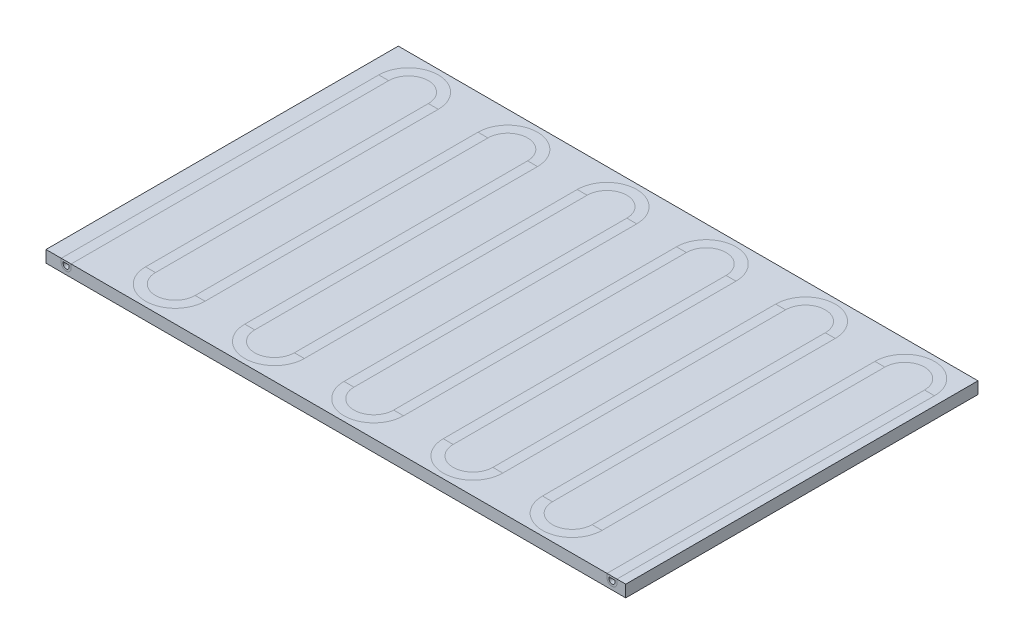
from build123d import *

# Parameters (mm, degrees)
SKETCH1_W        = 292.1
SKETCH1_H        = 177.5
BASE_PLATE_DEPTH = 6


with BuildPart() as part:
    # Sketch1 → Base Plate (new body)
    with BuildSketch(Plane(origin=(0, 0, 0), x_dir=(1, 0, 0), z_dir=(0, 1, 0))):
        Rectangle(SKETCH1_W, SKETCH1_H)
    extrude(amount=BASE_PLATE_DEPTH)

    # Tube Channel: sweep along a path in Sketch5
    with BuildLine(Plane(origin=(0, 6, 0), x_dir=(1, 0, 0), z_dir=(0, 1, 0))) as tube_channel_path:
        Line((-135.89, -88.75), (-135.89, 71.250000235))
        ThreePointArc((-135.89, 71.250000235), (-123.390000235, 83.75), (-110.89000047, 71.250000235))
        Line((-110.89000047, 71.250000235), (-110.89000047, -71.250000235))
        ThreePointArc((-110.89000047, -71.250000235), (-98.390000705, -83.75), (-85.89000094, -71.250000235))
        Line((-85.89000094, -71.250000235), (-85.89000094, 71.250000235))
        ThreePointArc((-85.89000094, 71.250000235), (-73.390001175, 83.75), (-60.89000141, 71.250000235))
        Line((-60.89000141, 71.250000235), (-60.89000141, -71.250000235))
        ThreePointArc((-60.89000141, -71.250000235), (-48.390001645, -83.75), (-35.89000188, -71.250000235))
        Line((-35.89000188, -71.250000235), (-35.89000188, 71.250000235))
        ThreePointArc((-35.89000188, 71.250000235), (-23.390002115, 83.75), (-10.89000235, 71.250000235))
        Line((-10.89000235, 71.250000235), (-10.89000235, -71.250000235))
        ThreePointArc((-10.89000235, -71.250000235), (1.609997415, -83.75), (14.10999718, -71.250000235))
        Line((14.10999718, -71.250000235), (14.10999718, 71.250000235))
        ThreePointArc((14.10999718, 71.250000235), (26.609996945, 83.75), (39.10999671, 71.250000235))
        Line((39.10999671, 71.250000235), (39.10999671, -71.250000235))
        ThreePointArc((39.10999671, -71.250000235), (51.609996475, -83.75), (64.10999624, -71.250000235))
        Line((64.10999624, -71.250000235), (64.10999624, 71.250000235))
        ThreePointArc((64.10999624, 71.250000235), (76.609996005, 83.75), (89.10999577, 71.250000235))
        Line((89.10999577, 71.250000235), (89.10999577, -71.250000235))
        ThreePointArc((89.10999577, -71.250000235), (101.609995535, -83.75), (114.1099953, -71.250000235))
        Line((114.1099953, -71.250000235), (114.1099953, 71.250000235))
        ThreePointArc((114.1099953, 71.250000235), (126.609995065, 83.75), (139.10999483, 71.250000235))
        Line((139.10999483, 71.250000235), (139.10999483, -88.75))
    # Sketch6 → Tube Channel (sweep, cut)
    with BuildSketch(Plane.XY.offset(88.75)):
        with BuildLine():
            Line((-138.389999953, 4.095), (-138.389999953, 6))
            Line((-138.389999953, 6), (-133.390000047, 6))
            Line((-133.390000047, 6), (-133.390000047, 4.095))
            ThreePointArc((-133.390000047, 4.095), (-135.89, 1.595000047), (-138.389999953, 4.095))
        make_face()
    sweep(path=tube_channel_path.line, mode=Mode.SUBTRACT)


with BuildPart() as body_2:
    # Tubing: sweep along a path in Sketch5<3>
    with BuildLine(Plane(origin=(0, 6, 0), x_dir=(1, 0, 0), z_dir=(0, 1, 0))) as tubing_path:
        Line((-135.89, -88.75), (-135.89, 71.250000235))
        ThreePointArc((-135.89, 71.250000235), (-123.390000235, 83.75), (-110.89000047, 71.250000235))
        Line((-110.89000047, 71.250000235), (-110.89000047, -71.250000235))
        ThreePointArc((-110.89000047, -71.250000235), (-98.390000705, -83.75), (-85.89000094, -71.250000235))
        Line((-85.89000094, -71.250000235), (-85.89000094, 71.250000235))
        ThreePointArc((-85.89000094, 71.250000235), (-73.390001175, 83.75), (-60.89000141, 71.250000235))
        Line((-60.89000141, 71.250000235), (-60.89000141, -71.250000235))
        ThreePointArc((-60.89000141, -71.250000235), (-48.390001645, -83.75), (-35.89000188, -71.250000235))
        Line((-35.89000188, -71.250000235), (-35.89000188, 71.250000235))
        ThreePointArc((-35.89000188, 71.250000235), (-23.390002115, 83.75), (-10.89000235, 71.250000235))
        Line((-10.89000235, 71.250000235), (-10.89000235, -71.250000235))
        ThreePointArc((-10.89000235, -71.250000235), (1.609997415, -83.75), (14.10999718, -71.250000235))
        Line((14.10999718, -71.250000235), (14.10999718, 71.250000235))
        ThreePointArc((14.10999718, 71.250000235), (26.609996945, 83.75), (39.10999671, 71.250000235))
        Line((39.10999671, 71.250000235), (39.10999671, -71.250000235))
        ThreePointArc((39.10999671, -71.250000235), (51.609996475, -83.75), (64.10999624, -71.250000235))
        Line((64.10999624, -71.250000235), (64.10999624, 71.250000235))
        ThreePointArc((64.10999624, 71.250000235), (76.609996005, 83.75), (89.10999577, 71.250000235))
        Line((89.10999577, 71.250000235), (89.10999577, -71.250000235))
        ThreePointArc((89.10999577, -71.250000235), (101.609995535, -83.75), (114.1099953, -71.250000235))
        Line((114.1099953, -71.250000235), (114.1099953, 71.250000235))
        ThreePointArc((114.1099953, 71.250000235), (126.609995065, 83.75), (139.10999483, 71.250000235))
        Line((139.10999483, 71.250000235), (139.10999483, -88.75))
    # Sketch7 → Tubing (sweep)
    with BuildSketch(Plane.XY.offset(88.75)):
        with BuildLine():
            Line((-138.389999953, 4.095), (-138.389999953, 6))
            Line((-138.389999953, 6), (-133.390000047, 6))
            Line((-133.390000047, 6), (-133.390000047, 4.095))
            ThreePointArc((-133.390000047, 4.095), (-135.89, 1.595000047), (-138.389999953, 4.095))
        make_face()
        with BuildLine():
            Line((-137.389999921, 4.095), (-137.389999921, 4.999999968))
            Line((-137.389999921, 4.999999968), (-134.390000079, 4.999999968))
            Line((-134.390000079, 4.999999968), (-134.390000079, 4.095))
            ThreePointArc((-134.390000079, 4.095), (-135.89, 2.595000079), (-137.389999921, 4.095))
        make_face(mode=Mode.SUBTRACT)
    sweep(path=tubing_path.line)


solid = Compound([part.part, body_2.part])
